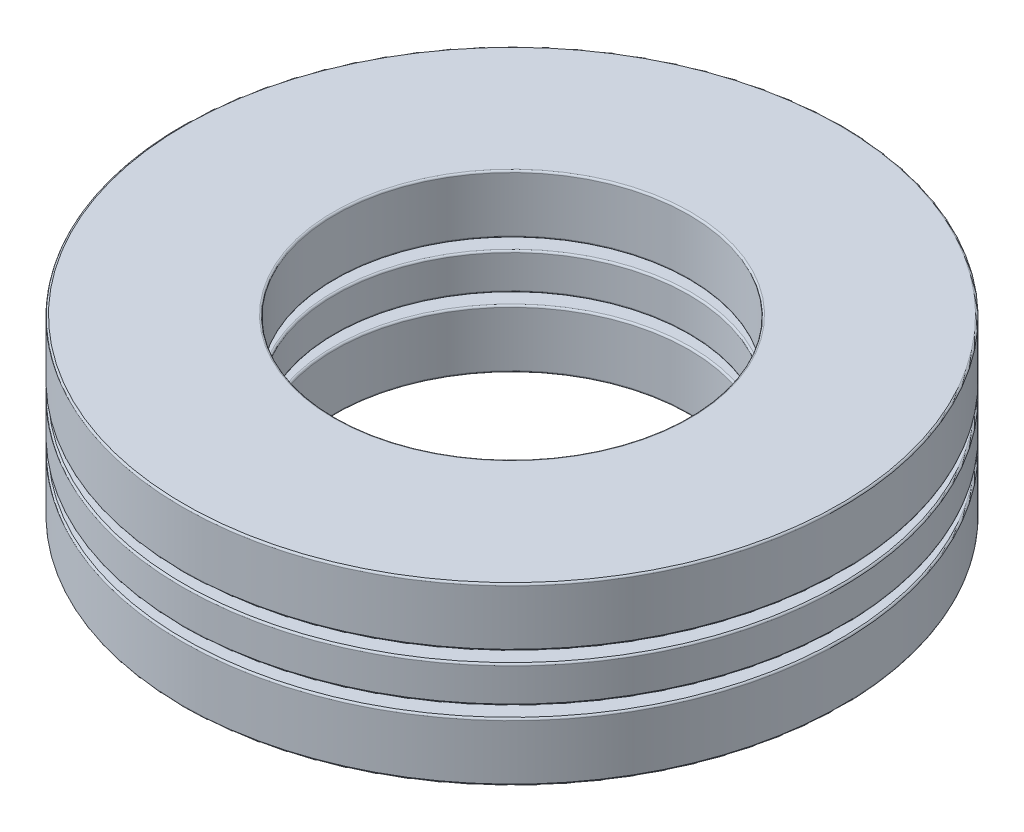
from build123d import *

# Parameters (mm, degrees)
SKETCH1_W         = 5.51815
SKETCH1_H         = 1.317625
CIRPATTERN1_COUNT = 5
CIRPATTERN1_ANGLE = 288
CIRPATTERN2_COUNT = 5
SKETCH4_W         = 5.51815
SKETCH4_H         = 2.1082
FILLET1_R         = 0.063246
FILLET2_R         = 0.063246
FILLET3_R         = 0.063246


with BuildPart() as part:
    # Sketch1 → Revolve1 (revolve)
    with BuildSketch(Plane(origin=(0, 0, 0), x_dir=(0, 0, -1), z_dir=(1, 0, 0))):
        with Locations((-9.147175, 0)):
            Rectangle(SKETCH1_W, SKETCH1_H)
    revolve(axis=Axis((0, -3.1623, 0), (0, 1, 0)))

    # Sketch3 → Cut-Revolve1 (revolve, cut)
    with BuildSketch(Plane(origin=(0, 0, 0), x_dir=(0, 0, -1), z_dir=(1, 0, 0))):
        with BuildLine():
            Line((-9.147175, 1.0541), (-9.147175, -1.0541))
            ThreePointArc((-9.147175, -1.0541), (-10.201275, 0), (-9.147175, 1.0541))
        make_face()
    cut_revolve1 = revolve(axis=Axis((0, 1.0541, 9.147175), (0, -1, 0)), mode=Mode.SUBTRACT)

    # CirPattern2: Cut-Revolve1 ×5 about axis
    cirpattern2_axis = Axis((0, 3.1623, 0), (0, -1, 0))
    for i in range(1, CIRPATTERN2_COUNT):
        add(cut_revolve1.rotate(cirpattern2_axis, i * 360 / CIRPATTERN2_COUNT), mode=Mode.SUBTRACT)

    # Fillet2
    fillet2_edges = [part.edges().sort_by_distance(p)[0] for p in [
        (0, -0.6588125, -6.3881),
        (0, 0.6588125, -6.3881),
        (0, -0.6588125, -11.90625),
        (0, 0.6588125, -11.90625),
    ]]
    fillet(fillet2_edges, radius=FILLET2_R)


with BuildPart() as body_2:
    # Sketch2 → Revolve2 (revolve)
    with BuildSketch(Plane(origin=(0, 0, 0), x_dir=(0, 0, -1), z_dir=(1, 0, 0))):
        with BuildLine():
            Line((-9.147175, 1.0541), (-9.147175, -1.0541))
            ThreePointArc((-9.147175, -1.0541), (-10.201275, 0), (-9.147175, 1.0541))
        make_face()
    revolve(axis=Axis((0, 1.0541, 9.147175), (0, -1, 0)))


with BuildPart() as cirpattern1_1:
    # CirPattern1: pattern copy
    add(body_2.part.rotate(Axis((0, 3.1623, 0), (0, -1, 0)), 1 * CIRPATTERN1_ANGLE / (CIRPATTERN1_COUNT - 1)))


with BuildPart() as cirpattern1_2:
    # CirPattern1: pattern copy
    add(body_2.part.rotate(Axis((0, 3.1623, 0), (0, -1, 0)), 2 * CIRPATTERN1_ANGLE / (CIRPATTERN1_COUNT - 1)))


with BuildPart() as cirpattern1_3:
    # CirPattern1: pattern copy
    add(body_2.part.rotate(Axis((0, 3.1623, 0), (0, -1, 0)), 3 * CIRPATTERN1_ANGLE / (CIRPATTERN1_COUNT - 1)))


with BuildPart() as cirpattern1_4:
    # CirPattern1: pattern copy
    add(body_2.part.rotate(Axis((0, 3.1623, 0), (0, -1, 0)), 4 * CIRPATTERN1_ANGLE / (CIRPATTERN1_COUNT - 1)))


with BuildPart() as body_7:
    # Sketch4 → Revolve3 (revolve)
    with BuildSketch(Plane(origin=(0, 0, 0), x_dir=(0, 0, -1), z_dir=(1, 0, 0))):
        with Locations((-9.147175, 2.1082)):
            Rectangle(SKETCH4_W, SKETCH4_H)
        with Locations((-9.147175, -2.1082)):
            Rectangle(SKETCH4_W, SKETCH4_H)
    revolve(axis=Axis((0, -3.1623, 0), (0, 1, 0)))

    # Fillet1
    fillet1_edges = [body_7.edges().sort_by_distance(p)[0] for p in [
        (0, 1.0541, -6.3881),
        (0, 3.1623, -6.3881),
        (0, 1.0541, -11.90625),
        (0, 3.1623, -11.90625),
    ]]
    fillet(fillet1_edges, radius=FILLET1_R)

    # Fillet3
    fillet3_edges = [body_7.edges().sort_by_distance(p)[0] for p in [
        (0, -3.1623, -6.3881),
        (0, -1.0541, -6.3881),
        (0, -3.1623, -11.90625),
        (0, -1.0541, -11.90625),
    ]]
    fillet(fillet3_edges, radius=FILLET3_R)


solid = Compound([part.part, body_2.part, cirpattern1_1.part, cirpattern1_2.part, cirpattern1_3.part, cirpattern1_4.part, body_7.part])
